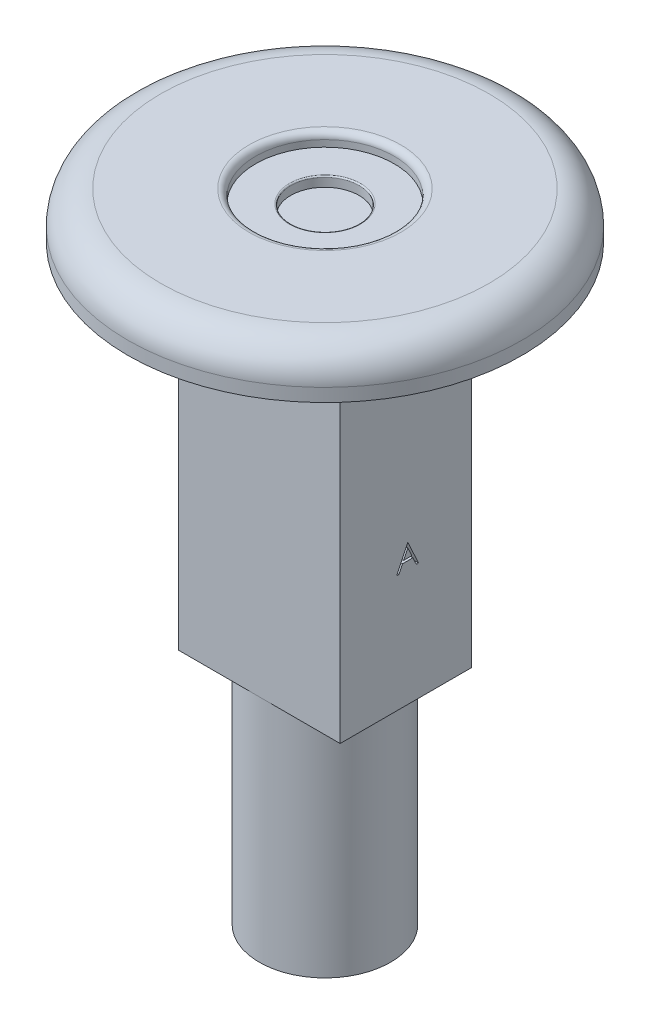
from build123d import *

# Parameters (mm, degrees)
FILLET1_R           = 1
SKETCH2_R           = 5.2
CUT_EXTRUDE1_DEPTH  = 1.5
FILLET2_R           = 0.2
FILLET3_R           = 5
CUT_EXTRUDE2_DEPTH  = 1
SKETCH6_R           = 10
BOSS_EXTRUDE1_DEPTH = 90
BOSS_EXTRUDE2_START = 10
SKETCH8_W           = 12.313661757
SKETCH8_H           = 20
BOSS_EXTRUDE2_DEPTH = 45
CUT_EXTRUDE5_DEPTH  = 2
CUT_EXTRUDE6_DEPTH  = 2


with BuildPart() as part:
    # Sketch1 → Revolve1 (revolve)
    with BuildSketch(Plane(origin=(0, 0, 0), x_dir=(0, 0, -1), z_dir=(1, 0, 0))):
        Polygon((0, 0), (-30, 0), (-30, 7), (-20.102542457, 7), (-10.55, 7), (-10.55, 5), (0, 5), align=None)
    revolve(axis=Axis((0, 5, 0), (0, -1, 0)))

    # Fillet1
    fillet1_edges = [part.edges().sort_by_distance(p)[0] for p in [
        (0, 7, -10.55),
    ]]
    fillet(fillet1_edges, radius=FILLET1_R)

    # Sketch2 → Cut-Extrude1 (cut)
    with BuildSketch(Plane(origin=(0, 5, 0), x_dir=(1, 0, 0), z_dir=(0, 1, 0))):
        Circle(SKETCH2_R)
    extrude(amount=-CUT_EXTRUDE1_DEPTH, mode=Mode.SUBTRACT)

    # Fillet2
    fillet2_edges = [part.edges().sort_by_distance(p)[0] for p in [
        (-5.2, 5, 0),
    ]]
    fillet(fillet2_edges, radius=FILLET2_R)

    # Fillet3
    fillet3_edges = [part.edges().sort_by_distance(p)[0] for p in [
        (0, 7, -30),
    ]]
    fillet(fillet3_edges, radius=FILLET3_R)

    # Sketch4 → Cut-Extrude2 (cut)
    # profile 1 of 4: a face of its own
    with BuildSketch(Plane.XZ):
        Polygon((-0.644909543, 25.480704332), (0.002225874, 25.480704332), (0.002225874, 21.980704332), (-0.31187669, 21.980704332), (-0.31187669, 25.121729973), (-0.850338229, 25.121729973), align=None)
    # profile 2 of 4: a face of its own
    with BuildSketch(Plane.XZ):
        with BuildLine():
            Line((25.523815675, 2.292498481), (25.209713111, 2.292498481))
            add(Edge.make_bspline(
                [(25.209713111, 2.292498481), (25.211760264, 2.334169369), (25.215780818, 2.416009884), (25.234609107, 2.53533379), (25.261549984, 2.649388589), (25.299641438, 2.757258503), (25.346947716, 2.85989731), (25.403677743, 2.956897326), (25.470871594, 3.047888515), (25.547078328, 3.132027358), (25.629846967, 3.209214929), (25.719152906, 3.275870171), (25.812997934, 3.332187843), (25.911097333, 3.379269085), (26.014557896, 3.414608931), (26.122440754, 3.44083057), (26.23521989, 3.456606916), (26.312059912, 3.458302702), (26.351139393, 3.459165148)],
                knots=[0, 0, 0, 0, 1.10065271, 2.161652631, 3.183658789, 4.190468796, 5.17591951, 6.163126047, 7.15150782, 8.156236427, 9.156009102, 10.134482811, 11.092018607, 12.041330605, 13.001268258, 13.972401359, 14.968799086, 16, 16, 16, 16], degree=3))
            add(Edge.make_bspline(
                [(26.351139393, 3.459165148), (26.389517467, 3.458266692), (26.464929011, 3.456501257), (26.574991026, 3.441340228), (26.67976832, 3.417594636), (26.779056087, 3.38427922), (26.872062151, 3.339494792), (26.959485196, 3.285697254), (27.042366007, 3.223477422), (27.11697279, 3.150223609), (27.18548087, 3.072021224), (27.244583125, 2.988533321), (27.295196288, 2.902304035), (27.337383968, 2.812675833), (27.368440107, 2.718804805), (27.392018315, 2.622057602), (27.405345729, 2.521432791), (27.407391152, 2.453326236), (27.408431059, 2.418700405)],
                knots=[0, 0, 0, 0, 1.111607364, 2.184268762, 3.212621178, 4.221274766, 5.211760367, 6.196651075, 7.1921475, 8.207485113, 9.220403448, 10.201281604, 11.166441695, 12.114753415, 13.065576456, 14.026450734, 14.996634279, 16, 16, 16, 16], degree=3))
            add(Edge.make_bspline(
                [(27.408431059, 2.418700405), (27.406744414, 2.369950595), (27.403400723, 2.273306467), (27.37454502, 2.13110211), (27.329962923, 1.99319705), (27.275889894, 1.882217998), (27.221269326, 1.793241105), (27.17308953, 1.719325464), (27.115437178, 1.640499047), (27.048839764, 1.555967938), (26.974301958, 1.465473568), (26.89128729, 1.368978802), (26.7991616, 1.267508497), (26.734503418, 1.198202684), (26.700999168, 1.162290148)],
                knots=[0, 0, 0, 0, 1.184203166, 2.347625244, 3.513805382, 4.700623107, 5.337941753, 6.051866363, 6.845199593, 7.711357327, 8.668078039, 9.695487809, 10.805859518, 12, 12, 12, 12], degree=3))
            Line((26.700999168, 1.162290148), (25.825298046, 0.228395917))
            Line((25.825298046, 0.228395917), (27.453302854, 0.228395917))
            Line((27.453302854, 0.228395917), (27.453302854, -0.130578442))
            Line((27.453302854, -0.130578442), (25.075097726, -0.130578442))
            Line((25.075097726, -0.130578442), (26.432469521, 1.317939187))
            add(Edge.make_bspline(
                [(26.432469521, 1.317939187), (26.465517408, 1.352437493), (26.528995635, 1.41870168), (26.618778212, 1.51544464), (26.6994172, 1.605194181), (26.771434593, 1.687780729), (26.833268098, 1.764412297), (26.88814033, 1.832607), (26.932105921, 1.895361451), (26.979821317, 1.968102065), (27.026035298, 2.056914382), (27.065747654, 2.165448071), (27.089962502, 2.277175324), (27.092867338, 2.352677361), (27.094328495, 2.390655533)],
                knots=[0, 0, 0, 0, 1.329631726, 2.553950428, 3.673215718, 4.687767853, 5.603093632, 6.413772471, 7.123043292, 7.734684054, 8.834405432, 9.900288307, 10.943827018, 12, 12, 12, 12], degree=3))
            add(Edge.make_bspline(
                [(27.094328495, 2.390655533), (27.093692753, 2.414536931), (27.092439827, 2.461602582), (27.081382129, 2.530608341), (27.064671623, 2.597173154), (27.040726365, 2.661501774), (27.009119625, 2.722947426), (26.970646245, 2.781584906), (26.926256182, 2.838273871), (26.874904912, 2.891427169), (26.818493393, 2.940108375), (26.758899143, 2.98323246), (26.695849039, 3.019271571), (26.629608917, 3.048815068), (26.560363447, 3.071990449), (26.487978702, 3.088049029), (26.412654686, 3.098131512), (26.36122119, 3.099495684), (26.335013591, 3.100190789)],
                knots=[0, 0, 0, 0, 0.991446411, 1.95395049, 2.89581595, 3.838931463, 4.798493298, 5.75982156, 6.748411868, 7.785213223, 8.824556874, 9.840280684, 10.836137867, 11.835679398, 12.848801643, 13.863922112, 14.911575587, 16, 16, 16, 16], degree=3))
            add(Edge.make_bspline(
                [(26.335013591, 3.100190789), (26.307642759, 3.099475757), (26.253890962, 3.098071552), (26.174971929, 3.088248888), (26.099686152, 3.071303047), (26.027844249, 3.048126373), (25.959324663, 3.018667824), (25.894460619, 2.981976079), (25.83339773, 2.938192586), (25.776021206, 2.88855203), (25.723157227, 2.833284429), (25.676710352, 2.771674466), (25.636126337, 2.70484705), (25.600717104, 2.6329825), (25.571961414, 2.55542872), (25.549988263, 2.472461015), (25.532601417, 2.384439633), (25.526792896, 2.323654549), (25.523815675, 2.292498481)],
                knots=[0, 0, 0, 0, 1.031018746, 2.02475058, 2.990194455, 3.934040569, 4.864654155, 5.795059489, 6.735614925, 7.690564532, 8.649604399, 9.611025574, 10.590972636, 11.591080095, 12.624614302, 13.701020113, 14.821632451, 16, 16, 16, 16], degree=3))
        make_face()
    # profile 3 of 4: a face of its own
    with BuildSketch(Plane.XZ):
        with BuildLine():
            Line((0.191598009, -25.382057247), (-0.122504556, -25.382057247))
            add(Edge.make_bspline(
                [(-0.122504556, -25.382057247), (-0.113995005, -25.346824763), (-0.097359529, -25.277948138), (-0.062661956, -25.179540878), (-0.024862701, -25.086417356), (0.020526404, -25.000321283), (0.070035158, -24.91952238), (0.12675788, -24.845853255), (0.188077602, -24.77744029), (0.255902552, -24.716727052), (0.327031213, -24.661749323), (0.402465833, -24.614874266), (0.480688727, -24.574550113), (0.56224186, -24.541329881), (0.647368031, -24.516304357), (0.735297655, -24.498147552), (0.826261155, -24.486356438), (0.888008745, -24.485205674), (0.919362432, -24.484621349)],
                knots=[0, 0, 0, 0, 1.162005537, 2.271625781, 3.343758855, 4.383309926, 5.390229558, 6.379919256, 7.361854164, 8.333198761, 9.295911338, 10.242430842, 11.177959212, 12.116337295, 13.062827104, 14.020064771, 14.994644689, 16, 16, 16, 16], degree=3))
            add(Edge.make_bspline(
                [(0.919362432, -24.484621349), (0.965045174, -24.48600058), (1.055414185, -24.488728955), (1.188177232, -24.513643392), (1.316204051, -24.553068524), (1.438093299, -24.607542251), (1.551311731, -24.674729564), (1.652047918, -24.754694301), (1.738936429, -24.845893603), (1.811830806, -24.946626167), (1.868905805, -25.054281676), (1.910992179, -25.165081833), (1.93661386, -25.278763805), (1.939934417, -25.355521084), (1.941598009, -25.393976317)],
                knots=[0, 0, 0, 0, 1.083050992, 2.142477498, 3.193116406, 4.255571735, 5.30263384, 6.308962982, 7.297363603, 8.282367274, 9.249857812, 10.179914175, 11.08814088, 12, 12, 12, 12], degree=3))
            add(Edge.make_bspline(
                [(1.941598009, -25.393976317), (1.940434418, -25.430983112), (1.93815745, -25.503399667), (1.918823745, -25.609121164), (1.886287482, -25.708762764), (1.841217719, -25.802743926), (1.782876169, -25.890468766), (1.712203472, -25.972134657), (1.628700811, -26.048103815), (1.565421872, -26.091623288), (1.532844002, -26.114028401)],
                knots=[0, 0, 0, 0, 1.024540389, 2.004866551, 2.965041327, 3.920577974, 4.882998113, 5.874504559, 6.905732034, 8, 8, 8, 8], degree=3))
            add(Edge.make_bspline(
                [(1.532844002, -26.114028401), (1.570075757, -26.132006572), (1.643842631, -26.16762653), (1.744393161, -26.237482287), (1.835671036, -26.318138635), (1.886574755, -26.381081288), (1.912150893, -26.412706285)],
                knots=[0, 0, 0, 0, 1.015518401, 2.012035669, 3.001164323, 4, 4, 4, 4], degree=3))
            add(Edge.make_bspline(
                [(1.912150893, -26.412706285), (1.928992236, -26.435764037), (1.962399132, -26.481501953), (2.003634665, -26.555038379), (2.04104378, -26.629389869), (2.070193999, -26.706549275), (2.092767866, -26.785622288), (2.108903898, -26.866744684), (2.118928039, -26.949982707), (2.120363591, -27.006295187), (2.121085188, -27.034601317)],
                knots=[0, 0, 0, 0, 1.025084078, 2.033381695, 3.024893161, 4.013698104, 4.991890475, 5.976764909, 6.982997093, 8, 8, 8, 8], degree=3))
            add(Edge.make_bspline(
                [(2.121085188, -27.034601317), (2.119290675, -27.083611039), (2.115710093, -27.18139984), (2.083706018, -27.325874562), (2.034092778, -27.467100064), (1.963635842, -27.602174904), (1.877768333, -27.728555285), (1.775611009, -27.841631594), (1.6583246, -27.938830198), (1.527518951, -28.020040426), (1.385801823, -28.084958348), (1.234226231, -28.130015791), (1.074976177, -28.159361791), (0.965768879, -28.16250866), (0.910247848, -28.164108529)],
                knots=[0, 0, 0, 0, 0.955779014, 1.907060117, 2.875433937, 3.871313158, 4.872415639, 5.851225146, 6.836215519, 7.83643374, 8.849228613, 9.86973379, 10.916971861, 12, 12, 12, 12], degree=3))
            add(Edge.make_bspline(
                [(0.910247848, -28.164108529), (0.872828548, -28.163240316), (0.799199843, -28.161531961), (0.690956345, -28.14985336), (0.587634645, -28.128523355), (0.489095047, -28.09982005), (0.395250011, -28.063428308), (0.306385906, -28.01810961), (0.221956012, -27.964798108), (0.142757061, -27.90286452), (0.068798493, -27.83358318), (0.002045769, -27.75572417), (-0.058614024, -27.670726766), (-0.111556662, -27.57760371), (-0.159193615, -27.477558453), (-0.198374572, -27.369309954), (-0.23286014, -27.253825932), (-0.248893605, -27.173348192), (-0.25711994, -27.132057247)],
                knots=[0, 0, 0, 0, 1.048658725, 2.063410685, 3.046034179, 4.001477787, 4.936774919, 5.862367409, 6.792675028, 7.730719943, 8.675894397, 9.627829632, 10.600096036, 11.597688215, 12.626045268, 13.701542398, 14.82072376, 16, 16, 16, 16], degree=3))
            Line((-0.25711994, -27.132057247), (0.056982624, -27.132057247))
            add(Edge.make_bspline(
                [(0.056982624, -27.132057247), (0.065165915, -27.15900626), (0.081083128, -27.211424432), (0.108177426, -27.286864737), (0.139045698, -27.356022791), (0.172160257, -27.419405913), (0.206938703, -27.477638315), (0.245853628, -27.529180184), (0.286022773, -27.576295386), (0.316302126, -27.602839998), (0.331121246, -27.615831285)],
                knots=[0, 0, 0, 0, 1.198163088, 2.33053128, 3.407730985, 4.417276592, 5.372219308, 6.28897303, 7.162600585, 8, 8, 8, 8], degree=3))
            add(Edge.make_bspline(
                [(0.331121246, -27.615831285), (0.350717822, -27.630939619), (0.389850485, -27.661109651), (0.453618716, -27.69961128), (0.520683602, -27.732972305), (0.592498277, -27.758456001), (0.667513047, -27.780033661), (0.746940412, -27.79415418), (0.830079629, -27.803842352), (0.886847393, -27.804697283), (0.915856823, -27.80513417)],
                knots=[0, 0, 0, 0, 0.946170439, 1.889420265, 2.845303464, 3.807233317, 4.801018734, 5.828864929, 6.890507805, 8, 8, 8, 8], degree=3))
            add(Edge.make_bspline(
                [(0.915856823, -27.80513417), (0.948610325, -27.804518265), (1.012656972, -27.803313915), (1.106111832, -27.792238208), (1.195019279, -27.776107795), (1.278392205, -27.751194812), (1.357322712, -27.720413961), (1.430704362, -27.681765555), (1.499500468, -27.636420833), (1.562829874, -27.584881675), (1.619775381, -27.52846018), (1.669914894, -27.469447109), (1.712539556, -27.408091279), (1.746923134, -27.344053158), (1.774073684, -27.277597929), (1.792556885, -27.2085391), (1.8054084, -27.137441834), (1.806455012, -27.089112865), (1.806982624, -27.064749555)],
                knots=[0, 0, 0, 0, 1.217147791, 2.380027433, 3.494444702, 4.572153297, 5.609568379, 6.639424714, 7.649109417, 8.668170816, 9.669597737, 10.625200337, 11.543417969, 12.441394052, 13.322311151, 14.205496177, 15.095365482, 16, 16, 16, 16], degree=3))
            add(Edge.make_bspline(
                [(1.806982624, -27.064749555), (1.805452322, -27.032138216), (1.802399334, -26.967077807), (1.779090755, -26.871360233), (1.74075189, -26.779136821), (1.687079379, -26.691981031), (1.62174365, -26.611205129), (1.545378744, -26.539133647), (1.457350515, -26.479663556), (1.376330646, -26.438574899), (1.30456549, -26.410537824), (1.243150105, -26.39186286), (1.174393502, -26.376049204), (1.099127153, -26.361336932), (1.016783936, -26.348815584), (0.927453498, -26.338373768), (0.831117737, -26.330018727), (0.764426571, -26.326287632), (0.730059547, -26.324364939)],
                knots=[0, 0, 0, 0, 1.07054697, 2.135767047, 3.216561865, 4.33974944, 5.486079747, 6.621378074, 7.775625952, 8.963672916, 9.598146892, 10.304877434, 11.070270905, 11.915000392, 12.823868403, 13.805723172, 14.86925407, 16, 16, 16, 16], degree=3))
            Line((0.730059547, -26.324364939), (0.730059547, -25.96539058))
            add(Edge.make_bspline(
                [(0.730059547, -25.96539058), (0.773360713, -25.964655776), (0.858177059, -25.963216476), (0.982071364, -25.945808466), (1.100544676, -25.921727838), (1.210971418, -25.884842646), (1.311620132, -25.842002349), (1.398939734, -25.792150139), (1.471706881, -25.73673539), (1.529567952, -25.674902781), (1.573097181, -25.608587733), (1.604923979, -25.539471076), (1.623724305, -25.466947015), (1.626233972, -25.417452347), (1.627495444, -25.392574074)],
                knots=[0, 0, 0, 0, 1.321986639, 2.589447074, 3.816329219, 5.01088745, 6.139805852, 7.153945165, 8.075214402, 8.924034688, 9.728124013, 10.488707548, 11.240355623, 12, 12, 12, 12], degree=3))
            add(Edge.make_bspline(
                [(1.627495444, -25.392574074), (1.627081034, -25.374296329), (1.626256583, -25.337933622), (1.615859305, -25.284808553), (1.600235264, -25.233307607), (1.578755535, -25.183649797), (1.550005336, -25.136179523), (1.515599349, -25.090492074), (1.474631249, -25.046848295), (1.427685802, -25.006167975), (1.377273997, -24.967398738), (1.322024222, -24.934485101), (1.263602347, -24.906340039), (1.201943692, -24.883130537), (1.136848162, -24.865671249), (1.068621604, -24.853135407), (0.997133921, -24.845297753), (0.948362189, -24.844169337), (0.923569162, -24.843595708)],
                knots=[0, 0, 0, 0, 0.884392785, 1.759457502, 2.611959086, 3.489218968, 4.37281399, 5.2945488, 6.255912374, 7.266815255, 8.301784654, 9.332968512, 10.37626691, 11.440494194, 12.520033166, 13.637162961, 14.798855837, 16, 16, 16, 16], degree=3))
            add(Edge.make_bspline(
                [(0.923569162, -24.843595708), (0.883717494, -24.84498707), (0.805877918, -24.847704724), (0.693663001, -24.871507737), (0.589343667, -24.909485821), (0.509605001, -24.95481884), (0.450722426, -24.999569274), (0.408645488, -25.038651661), (0.367324978, -25.082084484), (0.329479301, -25.13254286), (0.291205324, -25.18660965), (0.256360763, -25.247033331), (0.22250107, -25.312237726), (0.202098521, -25.35833336), (0.191598009, -25.382057247)],
                knots=[0, 0, 0, 0, 1.472543308, 2.876219568, 4.221790263, 5.565193594, 6.249813518, 6.953379497, 7.687249741, 8.463570142, 9.283606569, 10.136032583, 11.040678096, 12, 12, 12, 12], degree=3))
        make_face()
    # profile 4 of 4: a face of its own
    with BuildSketch(Plane.XZ):
        Polygon((-24.84722085, 3.262784403), (-24.783418767, 3.262784403), (-24.783418767, 0.83970748), (-24.379572613, 0.83970748), (-24.379572613, 0.480733121), (-24.783418767, 0.480733121), (-24.783418767, -0.326959187), (-25.097521331, -0.326959187), (-25.097521331, 0.480733121), (-26.757777741, 0.480733121), align=None)
        Polygon((-25.097521331, 0.83970748), (-25.097521331, 2.358337287), (-26.14008944, 0.83970748), align=None, mode=Mode.SUBTRACT)
    extrude(amount=-CUT_EXTRUDE2_DEPTH, mode=Mode.SUBTRACT)

    # Sketch6 → Boss-Extrude1 (add)
    with BuildSketch(Plane.XZ):
        Circle(SKETCH6_R)
    extrude(amount=BOSS_EXTRUDE1_DEPTH)

    # Sketch8 → Boss-Extrude2 (add)
    with BuildSketch(Plane(origin=(0, 0, 0), x_dir=(-1, 0, 0), z_dir=(0, -1, 0)).offset(BOSS_EXTRUDE2_START)):
        with Locations((-6.156830879, 0)):
            Rectangle(SKETCH8_W, SKETCH8_H)
        with BuildLine():
            Line((12.313661757, 10), (0, 10))
            ThreePointArc((0, 10), (10, 0), (0, -10))
            Line((0, -10), (12.313661757, -10))
            Line((12.313661757, -10), (12.313661757, 10))
        make_face()
    extrude(amount=BOSS_EXTRUDE2_DEPTH)

    # Sketch12 → Cut-Extrude5 (cut)
    with BuildSketch(Plane(origin=(12.313661757, 0, 0), x_dir=(0, 0, -1), z_dir=(1, 0, 0))):
        Polygon((0.322889874, -33.675221664), (1.93827449, -37.175221664), (1.596828176, -37.175221664), (1.079400291, -36.053426792), (-0.507238331, -36.053426792), (-1.038688651, -37.175221664), (-1.382238331, -37.175221664), (0.278018079, -33.675221664), align=None)
        Polygon((0.296948368, -34.358114292), (-0.336164613, -35.694452433), (0.913935547, -35.694452433), align=None, mode=Mode.SUBTRACT)
    extrude(amount=-CUT_EXTRUDE5_DEPTH, mode=Mode.SUBTRACT)

    # Sketch13 → Cut-Extrude6 (cut)
    with BuildSketch(Plane.ZY.offset(12.313661757)):
        with BuildLine():
            Line((-0.99287483, -31.753097959), (-0.309982202, -31.753097959))
            add(Edge.make_bspline(
                [(-0.309982202, -31.753097959), (-0.276553724, -31.753273709), (-0.211761013, -31.753614357), (-0.117541571, -31.758897488), (-0.029292761, -31.766101158), (0.053011011, -31.777531251), (0.129331714, -31.791323028), (0.199899351, -31.808024844), (0.264489523, -31.828051458), (0.34160226, -31.859897739), (0.429522921, -31.907220907), (0.524721313, -31.977149472), (0.606125553, -32.062681935), (0.67631187, -32.159164591), (0.73211299, -32.265300363), (0.772482287, -32.378559551), (0.798040162, -32.497481293), (0.800668596, -32.579124471), (0.801996965, -32.620385619)],
                knots=[0, 0, 0, 0, 1.001505555, 1.941167018, 2.826882275, 3.653841531, 4.429895133, 5.150066043, 5.825578002, 6.45369114, 7.647487171, 8.808567382, 9.977351308, 11.170798116, 12.373658725, 13.556498008, 14.765093433, 16, 16, 16, 16], degree=3))
            add(Edge.make_bspline(
                [(0.801996965, -32.620385619), (0.800903746, -32.659038175), (0.798755469, -32.734994092), (0.77821271, -32.846088201), (0.746052041, -32.95183942), (0.701346792, -33.051861805), (0.643244796, -33.143895418), (0.574386477, -33.228682684), (0.491309675, -33.302633741), (0.429066435, -33.343976644), (0.397449689, -33.364976965)],
                knots=[0, 0, 0, 0, 1.044552857, 2.05264487, 3.044412934, 4.028983338, 5.005914585, 5.980388656, 6.974128949, 8, 8, 8, 8], degree=3))
            add(Edge.make_bspline(
                [(0.397449689, -33.364976965), (0.437210117, -33.380241964), (0.513281664, -33.409447688), (0.617967677, -33.461083152), (0.708162522, -33.517245263), (0.784559668, -33.578577113), (0.849897322, -33.644685924), (0.906950264, -33.716541038), (0.955631638, -33.795079796), (0.997344562, -33.879483331), (1.029893318, -33.9688898), (1.054269222, -34.062460576), (1.068236671, -34.159860131), (1.070224313, -34.22614551), (1.071227734, -34.259608375)],
                knots=[0, 0, 0, 0, 1.27268992, 2.434971085, 3.483601985, 4.442670788, 5.356604649, 6.2567628, 7.179492994, 8.113709626, 9.066344395, 10.018646069, 10.999752585, 12, 12, 12, 12], degree=3))
            add(Edge.make_bspline(
                [(1.071227734, -34.259608375), (1.070250888, -34.293775247), (1.068328916, -34.360999526), (1.054148944, -34.45975466), (1.030139837, -34.554129607), (0.997068691, -34.644734789), (0.953906376, -34.731394924), (0.901378412, -34.814208188), (0.838746848, -34.892342518), (0.768683979, -34.966666142), (0.689421834, -35.033493929), (0.603906079, -35.093009636), (0.511059759, -35.141955698), (0.412407765, -35.183071719), (0.306843449, -35.214478918), (0.194840842, -35.236451492), (0.07649654, -35.251256529), (-0.004713211, -35.252473733), (-0.046360407, -35.253097959)],
                knots=[0, 0, 0, 0, 0.978564426, 1.925352924, 2.850884081, 3.763762016, 4.682927383, 5.618979971, 6.567305752, 7.547517671, 8.540179244, 9.531824382, 10.526200242, 11.540722885, 12.589160233, 13.674978461, 14.80764778, 16, 16, 16, 16], degree=3))
            Line((-0.046360407, -35.253097959), (-0.99287483, -35.253097959))
            Line((-0.99287483, -35.253097959), (-0.99287483, -31.753097959))
        make_face()
        with BuildLine():
            Line((-0.678772266, -32.112072318), (-0.678772266, -33.233867189))
            Line((-0.678772266, -33.233867189), (-0.467734606, -33.233867189))
            add(Edge.make_bspline(
                [(-0.467734606, -33.233867189), (-0.43688581, -33.233467266), (-0.377279651, -33.232694534), (-0.290959755, -33.230481017), (-0.210834736, -33.224282973), (-0.137042903, -33.218086711), (-0.069700459, -33.208012123), (-0.008956598, -33.196020001), (0.046141999, -33.183337095), (0.109681545, -33.161767609), (0.181754493, -33.129889933), (0.258587597, -33.080418097), (0.326322067, -33.021493744), (0.383519255, -32.953502782), (0.430330725, -32.878636596), (0.46284444, -32.798089716), (0.484891724, -32.713869584), (0.486883256, -32.656051331), (0.487894401, -32.626695715)],
                knots=[0, 0, 0, 0, 1.156816544, 2.235205308, 3.236616184, 4.169592532, 5.011045266, 5.787822928, 6.49130361, 7.128639758, 8.301311294, 9.436451833, 10.541879658, 11.654887649, 12.756523258, 13.837046038, 14.901820046, 16, 16, 16, 16], degree=3))
            add(Edge.make_bspline(
                [(0.487894401, -32.626695715), (0.487368221, -32.607269944), (0.486336061, -32.569164171), (0.477882758, -32.513614817), (0.463515184, -32.461371065), (0.44506089, -32.411716954), (0.419272202, -32.366205104), (0.388908738, -32.323261909), (0.352223048, -32.28434979), (0.310465735, -32.247980292), (0.262457113, -32.215735764), (0.208225821, -32.187495001), (0.147038144, -32.164754224), (0.079925289, -32.144838072), (0.005854201, -32.130849778), (-0.074320352, -32.11919639), (-0.161255071, -32.113263648), (-0.221400174, -32.112478285), (-0.252490215, -32.112072318)],
                knots=[0, 0, 0, 0, 0.91205012, 1.789085906, 2.630437955, 3.453916878, 4.269457761, 5.079663411, 5.91843418, 6.774407191, 7.675494373, 8.627863946, 9.638891023, 10.736472738, 11.911756761, 13.175263542, 14.539845004, 16, 16, 16, 16], degree=3))
            Line((-0.252490215, -32.112072318), (-0.678772266, -32.112072318))
        make_face(mode=Mode.SUBTRACT)
        with BuildLine():
            Line((-0.678772266, -33.592841548), (-0.678772266, -34.8941236))
            Line((-0.678772266, -34.8941236), (-0.231456561, -34.8941236))
            add(Edge.make_bspline(
                [(-0.231456561, -34.8941236), (-0.199437635, -34.893739852), (-0.137725376, -34.89300023), (-0.048624146, -34.890585675), (0.033958958, -34.885093399), (0.109647093, -34.87644755), (0.179257546, -34.867069101), (0.241955249, -34.85445782), (0.298248442, -34.840008859), (0.36352275, -34.817674687), (0.437026258, -34.782978216), (0.516237115, -34.73066399), (0.586663333, -34.668340682), (0.646468592, -34.596209768), (0.695481581, -34.517778441), (0.731137036, -34.434633091), (0.753127893, -34.348147563), (0.755790062, -34.289180851), (0.75712517, -34.259608375)],
                knots=[0, 0, 0, 0, 1.160039823, 2.235823828, 3.228722157, 4.157150951, 4.99529583, 5.772374946, 6.472645482, 7.099169577, 8.269452708, 9.405989375, 10.527446681, 11.663510218, 12.788923519, 13.866172445, 14.929861265, 16, 16, 16, 16], degree=3))
            add(Edge.make_bspline(
                [(0.75712517, -34.259608375), (0.756849066, -34.241115035), (0.756301311, -34.204426653), (0.748040696, -34.150510834), (0.736026826, -34.098284961), (0.720495392, -34.04760722), (0.697875925, -33.999393844), (0.67146938, -33.952691284), (0.640507978, -33.907437805), (0.592263812, -33.850225551), (0.522091828, -33.784308538), (0.422385052, -33.719771036), (0.309012754, -33.667723229), (0.226785261, -33.645623753), (0.184308664, -33.634207734)],
                knots=[0, 0, 0, 0, 0.723448775, 1.435228256, 2.130040452, 2.821711965, 3.505591119, 4.210454504, 4.921174351, 5.648778258, 7.137944449, 8.670945889, 10.280296675, 12, 12, 12, 12], degree=3))
            add(Edge.make_bspline(
                [(0.184308664, -33.634207734), (0.167279568, -33.63075265), (0.130356975, -33.623261316), (0.070149395, -33.615353612), (0.001413526, -33.608308552), (-0.076009351, -33.603097395), (-0.162217192, -33.597710851), (-0.257394111, -33.59561603), (-0.361151426, -33.59311677), (-0.433143798, -33.592935636), (-0.470539093, -33.592841548)],
                knots=[0, 0, 0, 0, 0.634451884, 1.375622551, 2.216452059, 3.157844607, 4.20941857, 5.370758133, 6.634282058, 8, 8, 8, 8], degree=3))
            Line((-0.470539093, -33.592841548), (-0.678772266, -33.592841548))
        make_face(mode=Mode.SUBTRACT)
    extrude(amount=-CUT_EXTRUDE6_DEPTH, mode=Mode.SUBTRACT)


solid = part.part
